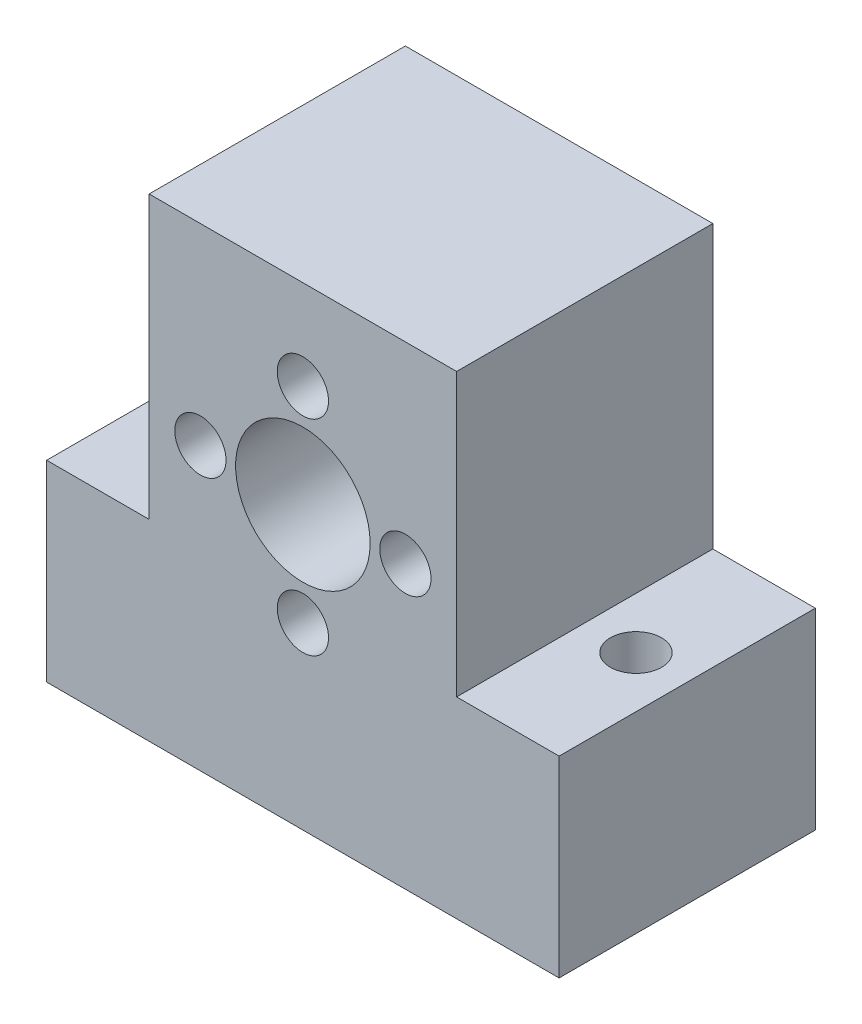
from build123d import *

# Parameters (mm, degrees)
SKETCH1_W           = 40
SKETCH1_H           = 37
SKETCH1_R           = 5.25
SKETCH1_R_2         = 2
BOSS_EXTRUDE1_DEPTH = 20
SKETCH2_R           = 2
CUT_EXTRUDE1_DEPTH  = 47.572524089
SKETCH3_W           = 8
SKETCH3_H           = 22
CUT_EXTRUDE2_DEPTH  = 36.832945734


with BuildPart() as part:
    # Sketch1 → Boss-Extrude1 (new body)
    with BuildSketch(Plane.XY):
        with Locations((0, -3.5)):
            Rectangle(SKETCH1_W, SKETCH1_H)
        Circle(SKETCH1_R, mode=Mode.SUBTRACT)
        with Locations((0, 8)):
            Circle(SKETCH1_R_2, mode=Mode.SUBTRACT)
        with Locations((8, 0)):
            Circle(SKETCH1_R_2, mode=Mode.SUBTRACT)
        with Locations((0, -8)):
            Circle(SKETCH1_R_2, mode=Mode.SUBTRACT)
        with Locations((-8, 0)):
            Circle(SKETCH1_R_2, mode=Mode.SUBTRACT)
    extrude(amount=BOSS_EXTRUDE1_DEPTH)

    # Sketch2 → Cut-Extrude1 (cut, through all)
    with BuildSketch(Plane(origin=(0, 15, 0), x_dir=(1, 0, 0), z_dir=(0, 1, 0))):
        with Locations((-16, -10)):
            Circle(SKETCH2_R)
        with Locations((16, -10)):
            Circle(SKETCH2_R)
    extrude(amount=-CUT_EXTRUDE1_DEPTH, mode=Mode.SUBTRACT)

    # Sketch3 → Cut-Extrude2 (cut, through all)
    with BuildSketch(Plane(origin=(0, 0, 0), x_dir=(-1, 0, 0), z_dir=(0, 0, -1))):
        with Locations((-16, 4)):
            Rectangle(SKETCH3_W, SKETCH3_H)
        with Locations((16, 4)):
            Rectangle(SKETCH3_W, SKETCH3_H)
    extrude(amount=-CUT_EXTRUDE2_DEPTH, mode=Mode.SUBTRACT)


solid = part.part
